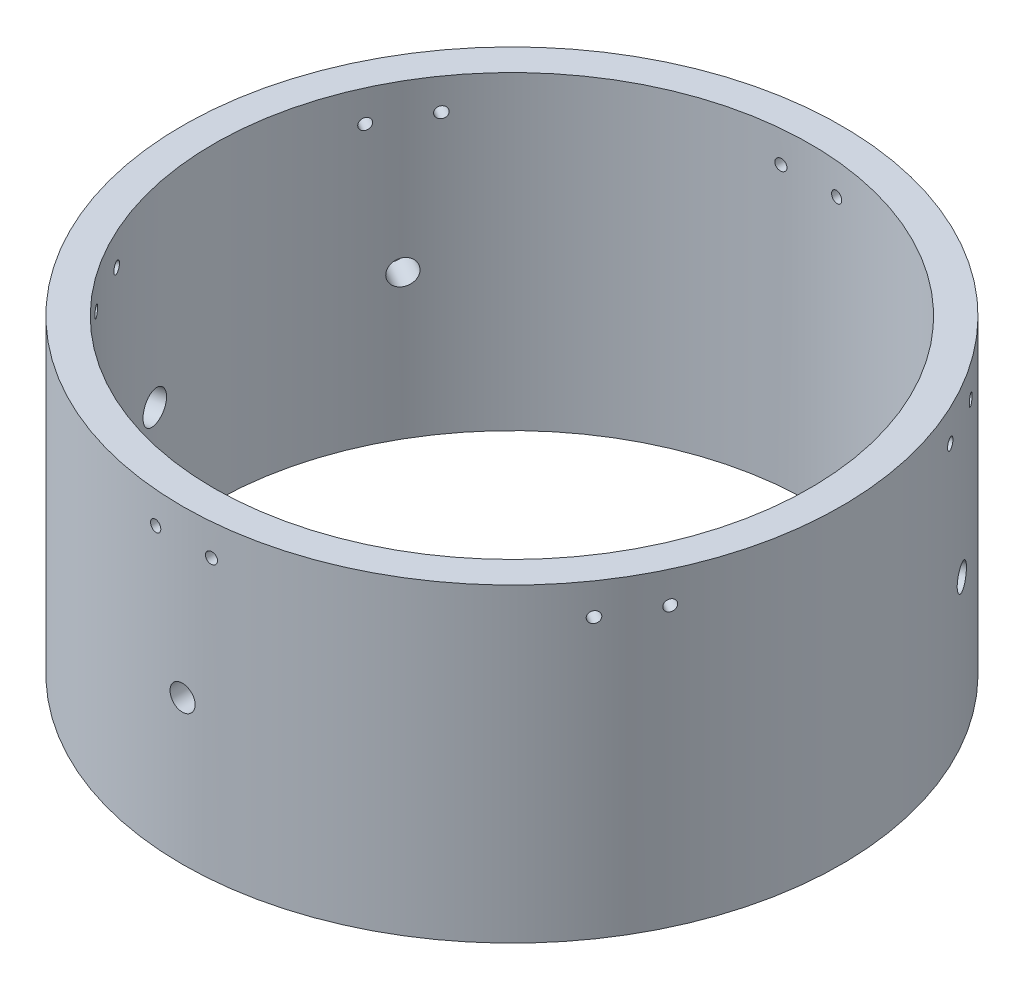
from build123d import *

# Parameters (mm, degrees)
SKETCH1_R               = 66.675
SKETCH1_R_2             = 1.0033
SKETCH1_R_3             = 60.325
BOSS_EXTRUDE1_DEPTH     = 62.738
CUT_EXTRUDE1_REACH      = 115.257
CUT_EXTRUDE1_END_RADIUS = 66.675
SKETCH2_R               = 1.1303
CIRPATTERN1_START       = -66.522012434
CIRPATTERN1_OUTLINE_R   = 1.1303
CIRPATTERN1_DEPTH       = 133.044024834
CIRPATTERN1_2_OUTLINE_R = 1.1303
CIRPATTERN1_2_DEPTH     = 133.044024834
CIRPATTERN1_3_OUTLINE_R = 1.1303
CIRPATTERN1_3_DEPTH     = 6.578635029
SKETCH1_6_R             = 1.0033
CUT_EXTRUDE3_DEPTH      = 12.7
CIRPATTERN2_COUNT       = 6
CIRPATTERN3_COUNT       = 3
CUT_EXTRUDE4_REACH      = 115.257
CUT_EXTRUDE4_END_RADIUS = 66.675
SKETCH3_R               = 3.429
CUT_EXTRUDE5_REACH      = 115.257
CUT_EXTRUDE5_END_RADIUS = 66.675
CIRPATTERN4_COUNT       = 2
CIRPATTERN4_ANGLE       = 18


# Read off the part's stored shape, not the designer's step: CirPattern1
with BuildPart() as part:
    # Sketch1 → Boss-Extrude1 (new body)
    # profile 1 of 2: a face of its own
    with BuildSketch(Plane(origin=(0, 0, 0), x_dir=(1, 0, 0), z_dir=(0, 1, 0))):
        with Locations(Location((0, 0, 0), (0, 0, 270))):
            Circle(SKETCH1_R)
        with Locations((31.75, -54.99261314)):
            Circle(SKETCH1_R_2, mode=Mode.SUBTRACT)
        with Locations(Location((0, 0, 0), (0, 0, 270))):
            Circle(SKETCH1_R_3, mode=Mode.SUBTRACT)
    # profile 2 of 2: a face of its own
    with BuildSketch(Plane(origin=(0, 0, 0), x_dir=(1, 0, 0), z_dir=(0, 1, 0))):
        with Locations((31.75, -54.99261314)):
            Circle(SKETCH1_R_2)
    extrude(amount=BOSS_EXTRUDE1_DEPTH)

    # Cut-Extrude1: up to this cylinder (the profile starts inside it)
    cut_extrude1_end = Plane(origin=(0, 42.799, 0), z_dir=(0, -1, 0)) * Cylinder(CUT_EXTRUDE1_END_RADIUS, 392.042, mode=Mode.PRIVATE)
    # Sketch2 → Cut-Extrude1 (cut, up to the surface)
    with BuildSketch(Plane.XY, mode=Mode.PRIVATE) as cut_extrude1_sk1:
        with Locations(Location((-5.644444444, 56.388, 0), (0, 0, 180))):
            Circle(SKETCH2_R)
    cut_extrude1_tool1 = extrude(cut_extrude1_sk1.sketch, amount=CUT_EXTRUDE1_REACH, mode=Mode.PRIVATE) & cut_extrude1_end
    # Sketch2 → Cut-Extrude1 (cut, up to the surface)
    with BuildSketch(Plane.XY, mode=Mode.PRIVATE) as cut_extrude1_sk2:
        with BuildLine():
            ThreePointArc((0, 31.75), (-2.54, 29.21), (0, 26.67))
            Line((0, 26.67), (0, 31.75))
        make_face()
    cut_extrude1_tool2 = extrude(cut_extrude1_sk2.sketch, amount=CUT_EXTRUDE1_REACH, mode=Mode.PRIVATE) & cut_extrude1_end
    # Sketch2 → Cut-Extrude1 (cut, up to the surface)
    with BuildSketch(Plane.XY, mode=Mode.PRIVATE) as cut_extrude1_sk3:
        with BuildLine():
            Line((0, 31.75), (0, 26.67))
            ThreePointArc((0, 26.67), (1.796051224, 27.413948776), (2.54, 29.21))
            ThreePointArc((2.54, 29.21), (1.796051224, 31.006051224), (0, 31.75))
        make_face()
    cut_extrude1_tool3 = extrude(cut_extrude1_sk3.sketch, amount=CUT_EXTRUDE1_REACH, mode=Mode.PRIVATE) & cut_extrude1_end
    # Sketch2 → Cut-Extrude1 (cut, up to the surface)
    with BuildSketch(Plane.XY, mode=Mode.PRIVATE) as cut_extrude1_sk4:
        with BuildLine():
            ThreePointArc((0, 31.75), (-2.54, 29.21), (0, 26.67))
            Line((0, 26.67), (0, 31.75))
        make_face()
    cut_extrude1_tool4 = extrude(cut_extrude1_sk4.sketch, amount=CUT_EXTRUDE1_REACH, mode=Mode.PRIVATE) & cut_extrude1_end
    # Sketch2 → Cut-Extrude1 (cut, up to the surface)
    with BuildSketch(Plane.XY, mode=Mode.PRIVATE) as cut_extrude1_sk5:
        with BuildLine():
            Line((0, 31.75), (0, 26.67))
            ThreePointArc((0, 26.67), (1.796051224, 27.413948776), (2.54, 29.21))
            ThreePointArc((2.54, 29.21), (1.796051224, 31.006051224), (0, 31.75))
        make_face()
    cut_extrude1_tool5 = extrude(cut_extrude1_sk5.sketch, amount=CUT_EXTRUDE1_REACH, mode=Mode.PRIVATE) & cut_extrude1_end
    cut_extrude1 = cut_extrude1_tool1.solids().sort_by_distance((-5.644444, 56.388, 0))[0] + cut_extrude1_tool2.solids().sort_by_distance((-1.078009, 29.21, 0))[0] + cut_extrude1_tool3.solids().sort_by_distance((1.078009, 29.21, 0))[0] + cut_extrude1_tool4.solids().sort_by_distance((-1.078009, 29.21, 0))[0] + cut_extrude1_tool5.solids().sort_by_distance((1.078009, 29.21, 0))[0]
    add(cut_extrude1, mode=Mode.SUBTRACT)

    # Mirror1: Cut-Extrude1 across plane
    add(cut_extrude1.mirror(Plane(origin=(0, 0, 0), x_dir=(0, 0, 1), z_dir=(1, 0, 0))), mode=Mode.SUBTRACT)

    # CirPattern1 outline → CirPattern1 (cut)
    with BuildSketch(Plane(origin=(0, 0, 0), x_dir=(0.5000000000000098, 0, 0.8660254037844329), z_dir=(0.8660254037844329, 0, -0.50000000000001)).offset(CIRPATTERN1_START)):
        with Locations((5.644444444, -56.388)):
            Circle(CIRPATTERN1_OUTLINE_R)
        with Locations((-5.644444444, -56.388)):
            Circle(CIRPATTERN1_OUTLINE_R)
    extrude(amount=CIRPATTERN1_DEPTH, mode=Mode.SUBTRACT)

    # CirPattern1 2 outline → CirPattern1 2 (cut)
    with BuildSketch(Plane(origin=(0, 0, 0), x_dir=(0.49999999999999195, 0, -0.8660254037844434), z_dir=(0.8660254037844433, 0, 0.4999999999999921)).offset(CIRPATTERN1_START)):
        with Locations((-5.644444444, 56.388)):
            Circle(CIRPATTERN1_2_OUTLINE_R)
        with Locations((5.644444444, 56.388)):
            Circle(CIRPATTERN1_2_OUTLINE_R)
    extrude(amount=CIRPATTERN1_2_DEPTH, mode=Mode.SUBTRACT)

    # CirPattern1 3 outline → CirPattern1 3 (cut)
    with BuildSketch(Plane.XY.offset(CIRPATTERN1_START)):
        with Locations((-5.644444444, 56.388)):
            Circle(CIRPATTERN1_3_OUTLINE_R)
        with Locations((5.644444444, 56.388)):
            Circle(CIRPATTERN1_3_OUTLINE_R)
    extrude(amount=CIRPATTERN1_3_DEPTH, mode=Mode.SUBTRACT)

    # Sketch1<6> → Cut-Extrude3 (cut)
    with BuildSketch(Plane(origin=(0, 0, 0), x_dir=(1, 0, 0), z_dir=(0, 1, 0))):
        with Locations(Location((31.75, -54.99261314, 0), (0, 0, 270))):
            Circle(SKETCH1_6_R)
    cut_extrude3 = extrude(amount=CUT_EXTRUDE3_DEPTH, mode=Mode.SUBTRACT)

    # CirPattern2: Cut-Extrude3 ×6 about axis
    cirpattern2_axis = Axis((0, 0, 0), (0, 1, 0))
    for i in range(1, CIRPATTERN2_COUNT):
        add(cut_extrude3.rotate(cirpattern2_axis, i * 360 / CIRPATTERN2_COUNT), mode=Mode.SUBTRACT)

    # CirPattern3: Cut-Extrude1 ×3 about axis
    cirpattern3_axis = Axis((0, 62.738, 0), (0, 1, 0))
    for i in range(1, CIRPATTERN3_COUNT):
        add(cut_extrude1.rotate(cirpattern3_axis, i * 360 / CIRPATTERN3_COUNT), mode=Mode.SUBTRACT)

    # Cut-Extrude4: up to this cylinder (the profile starts inside it)
    cut_extrude4_end = Plane(origin=(0, 10.668, 0), z_dir=(0, -1, 0)) * Cylinder(CUT_EXTRUDE4_END_RADIUS, 364.864, mode=Mode.PRIVATE)
    # Sketch3 → Cut-Extrude4 (cut, up to the surface)
    with BuildSketch(Plane(origin=(0, 0, 0), x_dir=(0.3746065934159098, 0, 0.9271838545667883), z_dir=(-0.9271838545667883, 0, 0.3746065934159098)), mode=Mode.PRIVATE) as cut_extrude4_sk1:
        with Locations(Location((0, 10.668, 0), (0, 0, 180))):
            Circle(SKETCH3_R)
    cut_extrude4_tool1 = extrude(cut_extrude4_sk1.sketch, amount=CUT_EXTRUDE4_REACH, mode=Mode.PRIVATE) & cut_extrude4_end
    add(cut_extrude4_tool1.solids().sort_by_distance((0, 10.668, 0))[0], mode=Mode.SUBTRACT)

    # Cut-Extrude5: up to this cylinder (the profile starts inside it)
    cut_extrude5_end = Plane(origin=(0, 24.13, 0), z_dir=(0, -1, 0)) * Cylinder(CUT_EXTRUDE5_END_RADIUS, 364.864, mode=Mode.PRIVATE)
    # Sketch5 → Cut-Extrude5 (cut, up to the surface)
    with BuildSketch(Plane(origin=(0, 0, 0), x_dir=(0, 1, 0), z_dir=(-0.8571673007021136, 0, 0.5150380749100523)), mode=Mode.PRIVATE) as cut_extrude5_sk1:
        with BuildLine():
            ThreePointArc((27.305, 0), (24.13, 3.175), (20.955, 0))
            Line((20.955, 0), (27.305, 0))
        make_face()
    cut_extrude5_tool1 = extrude(cut_extrude5_sk1.sketch, amount=CUT_EXTRUDE5_REACH, mode=Mode.PRIVATE) & cut_extrude5_end
    # Sketch5 → Cut-Extrude5 (cut, up to the surface)
    with BuildSketch(Plane(origin=(0, 0, 0), x_dir=(0, 1, 0), z_dir=(-0.8571673007021136, 0, 0.5150380749100523)), mode=Mode.PRIVATE) as cut_extrude5_sk2:
        with BuildLine():
            Line((27.305, 0), (20.955, 0))
            ThreePointArc((20.955, 0), (24.13, -3.175), (27.305, 0))
        make_face()
    cut_extrude5_tool2 = extrude(cut_extrude5_sk2.sketch, amount=CUT_EXTRUDE5_REACH, mode=Mode.PRIVATE) & cut_extrude5_end
    # Sketch5 → Cut-Extrude5 (cut, up to the surface)
    with BuildSketch(Plane(origin=(0, 0, 0), x_dir=(0, 1, 0), z_dir=(-0.8571673007021136, 0, 0.5150380749100523)), mode=Mode.PRIVATE) as cut_extrude5_sk3:
        with BuildLine():
            ThreePointArc((27.305, 0), (24.13, 3.175), (20.955, 0))
            Line((20.955, 0), (27.305, 0))
        make_face()
    cut_extrude5_tool3 = extrude(cut_extrude5_sk3.sketch, amount=CUT_EXTRUDE5_REACH, mode=Mode.PRIVATE) & cut_extrude5_end
    # Sketch5 → Cut-Extrude5 (cut, up to the surface)
    with BuildSketch(Plane(origin=(0, 0, 0), x_dir=(0, 1, 0), z_dir=(-0.8571673007021136, 0, 0.5150380749100523)), mode=Mode.PRIVATE) as cut_extrude5_sk4:
        with BuildLine():
            Line((27.305, 0), (20.955, 0))
            ThreePointArc((20.955, 0), (24.13, -3.175), (27.305, 0))
        make_face()
    cut_extrude5_tool4 = extrude(cut_extrude5_sk4.sketch, amount=CUT_EXTRUDE5_REACH, mode=Mode.PRIVATE) & cut_extrude5_end
    cut_extrude5 = cut_extrude5_tool1.solids().sort_by_distance((-0.69402, 24.13, -1.155043))[0] + cut_extrude5_tool2.solids().sort_by_distance((0.69402, 24.13, 1.155043))[0] + cut_extrude5_tool3.solids().sort_by_distance((-0.69402, 24.13, -1.155043))[0] + cut_extrude5_tool4.solids().sort_by_distance((0.69402, 24.13, 1.155043))[0]
    add(cut_extrude5, mode=Mode.SUBTRACT)

    # CirPattern4: Cut-Extrude5 ×2 about axis
    cirpattern4_axis = Axis((0, 62.738, 0), (0, -1, 0))
    for i in range(1, CIRPATTERN4_COUNT):
        add(cut_extrude5.rotate(cirpattern4_axis, i * CIRPATTERN4_ANGLE / (CIRPATTERN4_COUNT - 1)), mode=Mode.SUBTRACT)


solid = part.part
